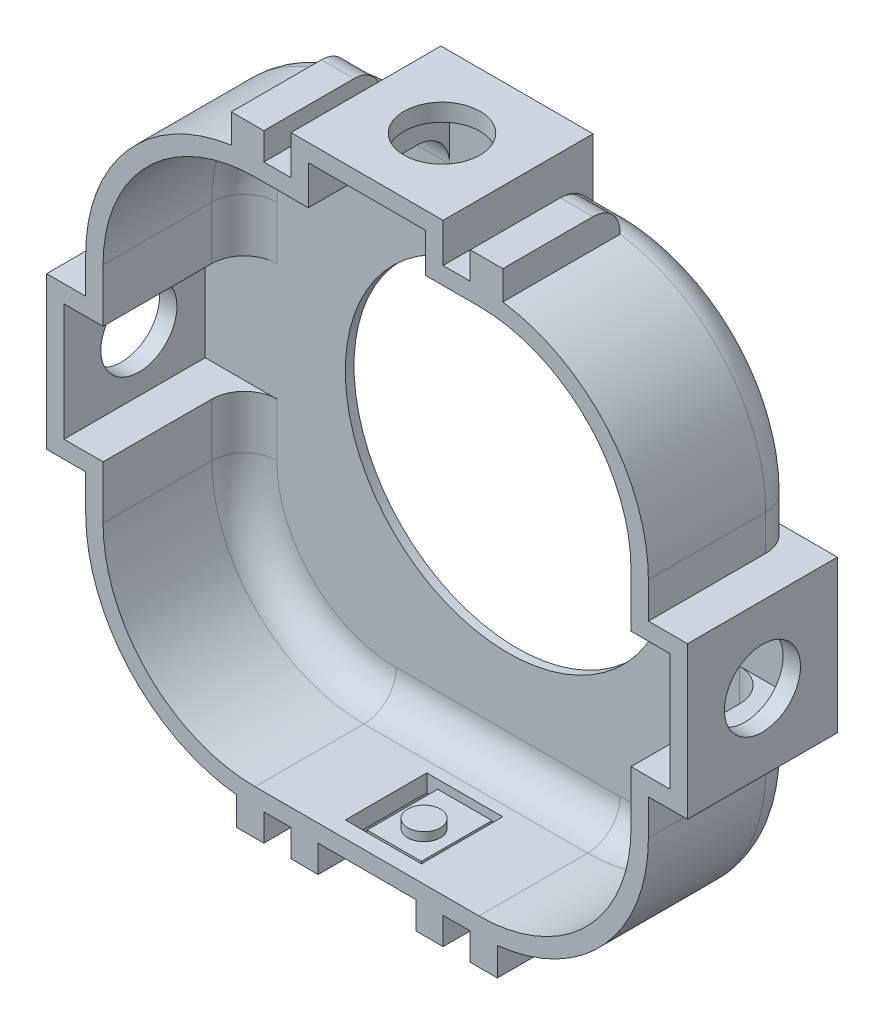
from build123d import *

# Parameters (mm, degrees)
EXTRUDE_1487_DEPTH     = 13
EXTRUDE_START          = -0.8
SKETCH_8_R             = 15
EXTRUDE_1654_DEPTH     = 0.8
CUT_EXTRUDE_1920_REACH = 69.233
SKETCH_1784_R          = 3.5
CUT_EXTRUDE_2148_REACH = 66.097
SKETCH_2017_R          = 3.5
CUT_EXTRUDE_2773_REACH = 66.097
CUT_EXTRUDE_2851_REACH = 66.897
CUT_EXTRUDE_START      = -0.8
SKETCH_3_W             = 5
SKETCH_3_H             = 6.5
SKETCH_3_R             = 1.5
FILLET_3030_R          = 3
FILLET_3594_R          = 3
EXTRUDE_START_2        = 2.2
SKETCH_4254_W          = 2.5
SKETCH_4254_H          = 2.5
EXTRUDE_4621_DEPTH     = 10.8
EXTRUDE_START_3        = 2.5
SKETCH_5_W             = 5
SKETCH_5_H             = 1.75
SKETCH_5_H_2           = 6.5
SKETCH_5_R             = 1.5
EXTRUDE_4751_DEPTH     = 2.5
FILLET_1_R             = 2.5


with BuildPart() as part:
    # Sketch 348 → Extrude 1487 (new body)
    with BuildSketch(Plane.XY):
        with BuildLine():
            Line((-10.3, -25.9), (10.3, -25.9))
            ThreePointArc((10.3, -25.9), (21.330865787, -21.330865787), (25.9, -10.3))
            Line((25.9, -10.3), (25.9, -7))
            Line((25.9, -7), (29.5, -7))
            Line((29.5, -7), (29.5, 7))
            Line((29.5, 7), (25.9, 7))
            Line((25.9, 7), (25.9, 10.3))
            ThreePointArc((25.9, 10.3), (21.330865787, 21.330865787), (10.3, 25.9))
            Line((10.3, 25.9), (7, 25.9))
            Line((7, 25.9), (7, 29.5))
            Line((7, 29.5), (-7, 29.5))
            Line((-7, 29.5), (-7, 25.9))
            Line((-7, 25.9), (-10.3, 25.9))
            ThreePointArc((-10.3, 25.9), (-21.330865787, 21.330865787), (-25.9, 10.3))
            Line((-25.9, 10.3), (-25.9, 7))
            Line((-25.9, 7), (-29.5, 7))
            Line((-29.5, 7), (-29.5, -7))
            Line((-29.5, -7), (-25.9, -7))
            Line((-25.9, -7), (-25.9, -10.3))
            ThreePointArc((-25.9, -10.3), (-21.330865787, -21.330865787), (-10.3, -25.9))
        make_face()
        with BuildLine():
            Line((-10.3, -24.3), (10.3, -24.3))
            ThreePointArc((10.3, -24.3), (20.199494937, -20.199494937), (24.3, -10.3))
            Line((24.3, -10.3), (24.3, -5.4))
            Line((24.3, -5.4), (27.9, -5.4))
            Line((27.9, -5.4), (27.9, 5.4))
            Line((27.9, 5.4), (24.3, 5.4))
            Line((24.3, 5.4), (24.3, 10.3))
            ThreePointArc((24.3, 10.3), (20.199494937, 20.199494937), (10.3, 24.3))
            Line((10.3, 24.3), (5.4, 24.3))
            Line((5.4, 24.3), (5.4, 27.9))
            Line((5.4, 27.9), (-5.4, 27.9))
            Line((-5.4, 27.9), (-5.4, 24.3))
            Line((-5.4, 24.3), (-10.3, 24.3))
            ThreePointArc((-10.3, 24.3), (-20.199494937, 20.199494937), (-24.3, 10.3))
            Line((-24.3, 10.3), (-24.3, 5.4))
            Line((-24.3, 5.4), (-27.9, 5.4))
            Line((-27.9, 5.4), (-27.9, -5.4))
            Line((-27.9, -5.4), (-24.3, -5.4))
            Line((-24.3, -5.4), (-24.3, -10.3))
            ThreePointArc((-24.3, -10.3), (-20.199494937, -20.199494937), (-10.3, -24.3))
        make_face(mode=Mode.SUBTRACT)
    extrude(amount=EXTRUDE_1487_DEPTH)

    # Эскиз-База<8> → Extrude 1654 (add)
    with BuildSketch(Plane.XY.offset(EXTRUDE_START)):
        with BuildLine():
            Line((-25.9, 7), (-29.5, 7))
            Line((-29.5, 7), (-29.5, -7))
            Line((-29.5, -7), (-25.9, -7))
            Line((-25.9, -7), (-25.9, -10.3))
            ThreePointArc((-25.9, -10.3), (-21.330865787, -21.330865787), (-10.3, -25.9))
            Line((-10.3, -25.9), (10.3, -25.9))
            ThreePointArc((10.3, -25.9), (21.330865787, -21.330865787), (25.9, -10.3))
            Line((25.9, -10.3), (25.9, -7))
            Line((25.9, -7), (29.5, -7))
            Line((29.5, -7), (29.5, 7))
            Line((29.5, 7), (25.9, 7))
            Line((25.9, 7), (25.9, 10.3))
            ThreePointArc((25.9, 10.3), (21.330865787, 21.330865787), (10.3, 25.9))
            Line((10.3, 25.9), (7, 25.9))
            Line((7, 25.9), (7, 29.5))
            Line((7, 29.5), (-7, 29.5))
            Line((-7, 29.5), (-7, 25.9))
            Line((-7, 25.9), (-10.3, 25.9))
            ThreePointArc((-10.3, 25.9), (-21.330865787, 21.330865787), (-25.9, 10.3))
            Line((-25.9, 10.3), (-25.9, 7))
        make_face()
        Circle(SKETCH_8_R, mode=Mode.SUBTRACT)
    extrude(amount=EXTRUDE_1654_DEPTH)

    # Sketch 1784 → Cut-Extrude 1920 (cut, up to next)
    with BuildSketch(Plane.ZY.offset(29.5), mode=Mode.PRIVATE) as cut_extrude_1920_sk1:
        with Locations(Location((6.1, 0, 0), (0, 0, 270))):
            Circle(SKETCH_1784_R)
    cut_extrude_1920_tool1 = extrude(cut_extrude_1920_sk1.sketch, amount=-CUT_EXTRUDE_1920_REACH, mode=Mode.PRIVATE) & part.part
    add(cut_extrude_1920_tool1.solids().sort_by_distance((-29.5, 0, 6.1))[0], mode=Mode.SUBTRACT)
    add(cut_extrude_1920_tool1.solids().sort_by_distance((-29.5, 0, 6.1))[1], mode=Mode.SUBTRACT)

    # Sketch 2017 → Cut-Extrude 2148 (cut, up to next)
    with BuildSketch(Plane(origin=(0, 29.5, 0), x_dir=(1, 0, 0), z_dir=(0, 1, 0)), mode=Mode.PRIVATE) as cut_extrude_2148_sk1:
        with Locations(Location((0, -6.1, 0), (0, 0, 180))):
            Circle(SKETCH_2017_R)
    cut_extrude_2148_tool1 = extrude(cut_extrude_2148_sk1.sketch, amount=-CUT_EXTRUDE_2148_REACH, mode=Mode.PRIVATE) & part.part
    add(cut_extrude_2148_tool1.solids().sort_by_distance((0, 29.5, 6.1))[0], mode=Mode.SUBTRACT)

    # Sketch 2270 → Cut-Extrude 2773 (cut, up to next)
    with BuildSketch(Plane.XZ.offset(25.9), mode=Mode.PRIVATE) as cut_extrude_2773_sk1:
        Polygon((3.5, 11.5), (3.5, 4), (2.5, 4), (2.5, 10.5), (-2.5, 10.5), (-2.5, 4), (-3.5, 4), (-3.5, 11.5), align=None)
    cut_extrude_2773_tool1 = extrude(cut_extrude_2773_sk1.sketch, amount=-CUT_EXTRUDE_2773_REACH, mode=Mode.PRIVATE) & part.part
    add(cut_extrude_2773_tool1.solids().sort_by_distance((3.397409, -25.9, 7.75))[0], mode=Mode.SUBTRACT)

    # Эскиз-Кнопка записи<3> → Cut-Extrude 2851 (cut, up to next)
    with BuildSketch(Plane.XZ.offset(25.9).offset(CUT_EXTRUDE_START), mode=Mode.PRIVATE) as cut_extrude_2851_sk1:
        with Locations((0, 7.25)):
            Rectangle(SKETCH_3_W, SKETCH_3_H)
        with Locations(Location((0, 7.75, 0), (0, 0, 270))):
            Circle(SKETCH_3_R, mode=Mode.SUBTRACT)
    cut_extrude_2851_tool1 = extrude(cut_extrude_2851_sk1.sketch, amount=-CUT_EXTRUDE_2851_REACH, mode=Mode.PRIVATE) & part.part
    add(cut_extrude_2851_tool1.solids().sort_by_distance((-2.417994, -25.1, 7.25))[0], mode=Mode.SUBTRACT)

    # Fillet 3030
    fillet_3030_edges = [part.edges().sort_by_distance(p)[0] for p in [
        (-7.85, 24.3, 0),
        (-20.199494937, 20.199494937, 0),
        (-24.3, -7.85, 0),
        (-20.199494937, -20.199494937, 0),
        (20.199494937, -20.199494937, 0),
        (20.199494937, 20.199494937, 0),
        (7.85, 24.3, 0),
        (24.3, 7.85, 0),
        (24.3, -7.85, 0),
        (0, -24.3, 0),
        (-24.3, 7.85, 0),
    ]]
    fillet(fillet_3030_edges, radius=FILLET_3030_R)

    # Fillet 3594
    fillet_3594_edges = [part.edges().sort_by_distance(p)[0] for p in [
        (-21.330865787, 21.330865787, -0.8),
        (-8.65, 25.9, -0.8),
        (8.65, 25.9, -0.8),
        (21.330865787, 21.330865787, -0.8),
        (25.9, 8.65, -0.8),
        (25.9, -8.65, -0.8),
        (21.330865787, -21.330865787, -0.8),
        (0, -25.9, -0.8),
        (-21.330865787, -21.330865787, -0.8),
        (-25.9, -8.65, -0.8),
        (-25.9, 8.65, -0.8),
    ]]
    fillet(fillet_3594_edges, radius=FILLET_3594_R)

    # Sketch 4254 → Extrude 4621 (add)
    with BuildSketch(Plane.XY.offset(EXTRUDE_START_2)):
        Polygon((-9.5, 25.9), (-9.5, 28.4), (-12.5, 28.4), (-12.5, 25.4), align=None)
        Polygon((12, -25.4), (9.5, -25.9), (9.5, -28.4), (12, -28.4), align=None)
        Polygon((9.5, 25.9), (9.5, 28.4), (12.5, 28.4), (12.5, 25.4), align=None)
        Polygon((-9.5, -25.9), (-9.5, -28.4), (-12, -28.4), (-12, -25.4), align=None)
        with Locations((-5.75, -27.15)):
            Rectangle(SKETCH_4254_W, SKETCH_4254_H)
        with Locations((5.75, -27.15)):
            Rectangle(SKETCH_4254_W, SKETCH_4254_H)
    extrude(amount=EXTRUDE_4621_DEPTH)

    # Эскиз-Кнопка записи<5> → Extrude 4751 (add)
    # profile 1 of 3: a face of its own
    with BuildSketch(Plane.XZ.offset(25.9).offset(EXTRUDE_START_3)):
        with Locations((0, 3.125)):
            Rectangle(SKETCH_5_W, SKETCH_5_H)
    # profile 2 of 3: a face of its own
    with BuildSketch(Plane.XZ.offset(25.9).offset(EXTRUDE_START_3)):
        with Locations((0, 7.25)):
            Rectangle(SKETCH_5_W, SKETCH_5_H_2)
        with Locations(Location((0, 7.75, 0), (0, 0, 270))):
            Circle(SKETCH_5_R, mode=Mode.SUBTRACT)
    # profile 3 of 3: a face of its own
    with BuildSketch(Plane.XZ.offset(25.9).offset(EXTRUDE_START_3)):
        with Locations(Location((0, 7.75, 0), (0, 0, 270))):
            Circle(SKETCH_5_R)
    extrude(amount=-EXTRUDE_4751_DEPTH)

    # Скругление1
    fillet_1_edges = [part.edges().sort_by_distance(p)[0] for p in [
        (10.75, -28.4, 2.2),
        (5.75, -28.4, 2.2),
        (-10.75, -28.4, 2.2),
        (-5.75, -28.4, 2.2),
        (0, -28.4, 2.25),
        (11, 28.4, 2.2),
        (-11, 28.4, 2.2),
    ]]
    fillet(fillet_1_edges, radius=FILLET_1_R - 0.0001)  # a hair under: the kernel refuses the full size


solid = part.part
